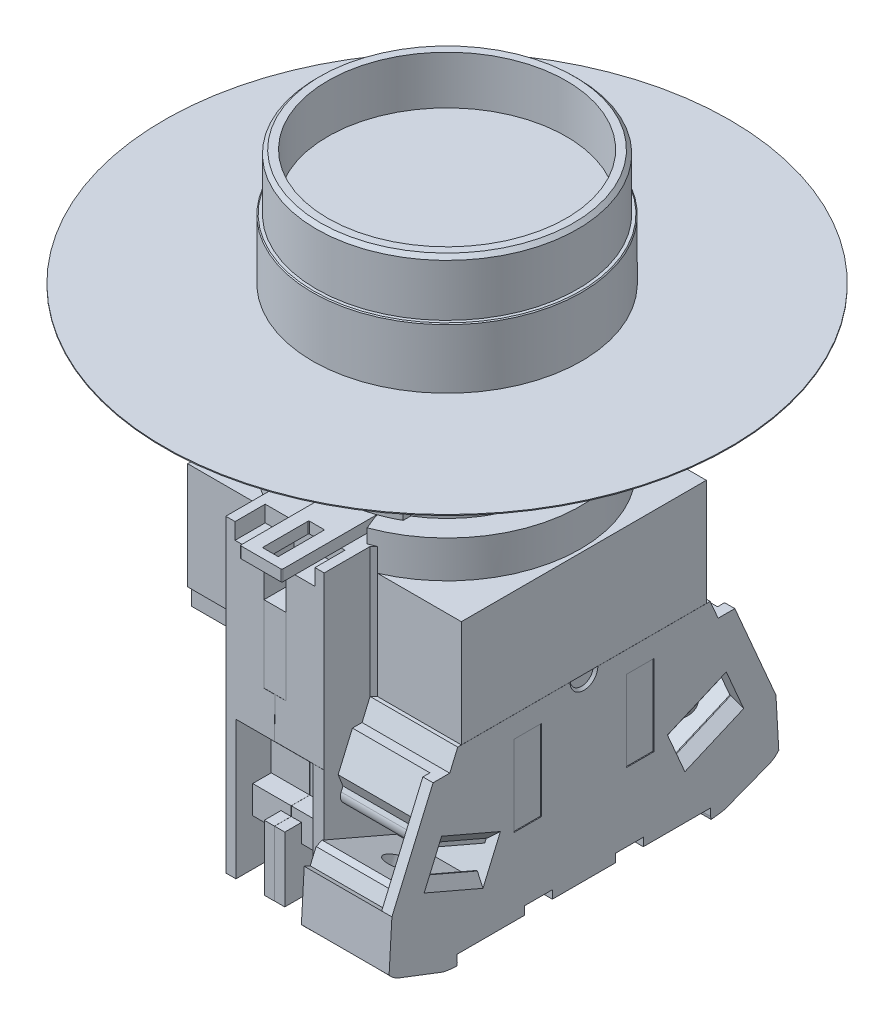
from build123d import *

# Parameters (mm, degrees)
SKETCH_2_R                  = 14.075
EXTRUDE_1_DEPTH             = 6
SKETCH_3_R                  = 14.5
EXTRUDE_2_DEPTH             = 6.5
CHAMFER_1_SIZE              = 0.4
CHAMFER_2_SIZE              = 0.1
SKETCH_4_R                  = 12.85
CUT_EXTRUDE_1_DEPTH         = 5.2
SKETCH_5_R                  = 10.925
EXTRUDE_3_DEPTH             = 12.9
EXTRUDE_4_DEPTH             = 0.7
SKETCH_8_R                  = 14.375
EXTRUDE_5_DEPTH             = 4
CUT_EXTRUDE_2_DEPTH         = 1.5
SKETCH_11_W                 = 10.2
SKETCH_11_H                 = 1.5
CUT_EXTRUDE_4_DEPTH         = 9
FILLET_1_R                  = 2
SKETCH_12_W                 = 4.5
SKETCH_12_H                 = 1.2
EXTRUDE_6_DEPTH             = 12
SKETCH_16_W                 = 1.7
SKETCH_16_H                 = 5
CUT_EXTRUDE_6_DEPTH         = 38.087194556
FILLET_5_R                  = 0.1
SKETCH_17_W                 = 29.5
SKETCH_17_H                 = 26.4
EXTRUDE_9_DEPTH             = 11.5
SKETCH_18_W                 = 29.5
SKETCH_18_H                 = 25.6
EXTRUDE_10_DEPTH            = 2
SKETCH_19_W                 = 29.5
SKETCH_19_H                 = 11
EXTRUDE_11_DEPTH            = 0.3
EXTRUDE_12_DEPTH            = 5.3
EXTRUDE_12_DEPTH_BACK       = 5.3
SKETCH_21_W                 = 37.1
SKETCH_21_H                 = 33.3
CHAMFER_START               = -35.6
CHAMFER_3_DEPTH             = 14
SKETCH_22_W                 = 10
SKETCH_22_H                 = 7.4
SKETCH_22_W_2               = 4
SKETCH_22_H_2               = 15.4
CUT_EXTRUDE_7_DEPTH         = 2.1
EXTRUDE_13_DEPTH            = 1
EXTRUDE_13_DEPTH_BACK       = 1
SKETCH_26_W                 = 8.6
SKETCH_26_H                 = 6.5
CUT_EXTRUDE_8_DEPTH         = 1.75
SKETCH_28_W                 = 8.6
SKETCH_28_H                 = 1
CUT_EXTRUDE_9_DEPTH         = 0.5
CHAMFER_4_SIZE              = 0.5
SKETCH_29_W                 = 2.4
SKETCH_29_H                 = 3.25
CUT_EXTRUDE_10_DEPTH        = 4
SKETCH_30_W                 = 8.3
SKETCH_30_H                 = 14.9
CUT_EXTRUDE_11_DEPTH        = 3.8
CHAMFER_5_SIZE              = 3.8
SKETCH_31_W                 = 8.3
SKETCH_31_H                 = 3
EXTRUDE_14_DEPTH            = 2
CHAMFER_7_SIZE              = 2
SKETCH_33_W                 = 2.2
SKETCH_33_H                 = 7
EXTRUDE_15_DEPTH            = 3.8
EXTRUDE_16_DEPTH            = 9.45
EXTRUDE_17_DEPTH            = 9.45
SKETCH_39_W                 = 27.2
SKETCH_39_H                 = 11.5
CUT_EXTRUDE_12_DEPTH        = 0.01
MIRROR_START                = -4.2
MIRROR_1_OUTLINE_W          = 1.75
MIRROR_1_OUTLINE_H          = 3.25
MIRROR_1_DEPTH              = 8.3
MIRROR_1_2_DEPTH            = 3.05
MIRROR_START_2              = 1.05
MIRROR_1_3_DEPTH            = 3.05
MIRROR_START_3              = -1.2
MIRROR_1_4_OUTLINE_W        = 4
MIRROR_1_4_OUTLINE_H        = 3.25
MIRROR_1_4_DEPTH            = 2.4
MIRROR_START_4              = -4.3
MIRROR_1_5_OUTLINE_W        = 1.75
MIRROR_1_5_OUTLINE_H        = 3.25
MIRROR_1_5_DEPTH            = 8.6
SKETCH_41_W                 = 2.4
SKETCH_41_H                 = 8.25
CUT_EXTRUDE_13_DEPTH        = 0.02
CUT_EXTRUDE_14_DEPTH        = 0.01
SKETCH_44_W                 = 4.15
SKETCH_44_H                 = 5.374011537
CUT_EXTRUDE_15_DEPTH        = 0.01
SKETCH_45_W                 = 4.15
SKETCH_45_H                 = 3.1
CUT_EXTRUDE_16_DEPTH        = 0.01
SKETCH_46_W                 = 4.15
SKETCH_46_H                 = 2.01
CUT_EXTRUDE_17_DEPTH        = 0.01
CUT_EXTRUDE_18_DEPTH        = 0.01
SKETCH_48_W                 = 3.05
SKETCH_48_H                 = 2.828427125
CUT_EXTRUDE_19_DEPTH        = 0.01
SKETCH_49_W                 = 3.05
SKETCH_49_H                 = 3
CUT_EXTRUDE_20_DEPTH        = 0.01
SKETCH_50_W                 = 1.1
SKETCH_50_H                 = 7
CUT_EXTRUDE_21_DEPTH        = 0.01
SKETCH_52_W                 = 1.1
SKETCH_52_H                 = 1.79
CUT_EXTRUDE_24_DEPTH        = 0.01
SKETCH_55_W                 = 8.35
SKETCH_55_H                 = 11.214030016
CUT_EXTRUDE_25_DEPTH        = 0.7
SKETCH_56_W                 = 8.35
SKETCH_56_H                 = 0.7
CUT_EXTRUDE_26_DEPTH        = 0.7
SKETCH_57_W                 = 8.35
SKETCH_57_H                 = 4.5
CUT_EXTRUDE_27_DEPTH        = 8.7
CHAMFER_8_SIZE              = 1
CHAMFER_9_SIZE              = 0.5
CHAMFER_8_OF_MIRROR_2_SIZE  = 1
CHAMFER_9_OF_MIRROR_2_SIZE  = 0.5
SKETCH_58_W                 = 3
SKETCH_58_H                 = 8.7
CUT_EXTRUDE_28_DEPTH        = 0.1
CUT_EXTRUDE_29_DEPTH        = 9.45
CHAMFER_10_SIZE             = 1
CHAMFER_10_OF_MIRROR_4_SIZE = 1
SKETCH_62_W                 = 3
SKETCH_62_H                 = 1.69
CUT_EXTRUDE_30_DEPTH        = 1.77
SKETCH_63_W                 = 27.3
SKETCH_63_H                 = 0.8
CUT_EXTRUDE_31_DEPTH        = 64.419259781
SKETCH_64_R                 = 2.5
CUT_EXTRUDE_32_DEPTH        = 3
SKETCH_65_R                 = 1.6
CUT_EXTRUDE_33_DEPTH        = 6
CUT_EXTRUDE_34_DEPTH        = 4.8
SKETCH_69_W                 = 8.35
SKETCH_69_H                 = 1.040401342
SKETCH_69_H_2               = 0.709598658
CUT_EXTRUDE_35_DEPTH        = 0.5
SKETCH_70_W                 = 8.35
SKETCH_70_H                 = 1.5
EXTRUDE_19_DEPTH            = 8.2
FILLET_7_R                  = 1
FILLET_7_OF_MIRROR_6_R      = 1
SKETCH_71_W                 = 8.2
SKETCH_71_H                 = 4.985857864
SKETCH_71_W_2               = 0.77
CUT_EXTRUDE_36_DEPTH        = 8
EXTRUDE_20_DEPTH            = 0.8
CHAMFER_11_SIZE             = 0.2
SKETCH_74_W                 = 1
SKETCH_74_H                 = 2
CUT_EXTRUDE_37_DEPTH        = 0.5
CHAMFER_12_SIZE             = 0.5
SKETCH_76_W                 = 1
SKETCH_76_H                 = 14
CUT_EXTRUDE_38_DEPTH        = 0.01
SKETCH_77_R                 = 30.5
EXTRUDE_21_DEPTH            = 0.1
SKETCH_78_R                 = 14.5
CUT_EXTRUDE_40_DEPTH        = 0.1


with BuildPart() as part:
    # ｽｹｯﾁ2 → ﾎﾞｽ - 押し出し1 (new body)
    with BuildSketch(Plane(origin=(0, 0, 0), x_dir=(1, 0, 0), z_dir=(0, 1, 0))):
        with Locations(Location((0, 0, 0), (0, 0, 270))):
            Circle(SKETCH_2_R)
    extrude(amount=EXTRUDE_1_DEPTH)

    # ｽｹｯﾁ3 → ﾎﾞｽ - 押し出し2 (add)
    with BuildSketch(Plane.XZ):
        with Locations(Location((0, 0, 0), (0, 0, 90))):
            Circle(SKETCH_3_R)
    extrude(amount=EXTRUDE_2_DEPTH)

    # 面取り1
    chamfer_1_edges = [part.edges().sort_by_distance(p)[0] for p in [
        (0, 6, -14.075),
    ]]
    chamfer(chamfer_1_edges, length=CHAMFER_1_SIZE)

    # 面取り2
    chamfer_2_edges = [part.edges().sort_by_distance(p)[0] for p in [
        (0, 0, -14.5),
    ]]
    chamfer(chamfer_2_edges, length=CHAMFER_2_SIZE)

    # ｽｹｯﾁ4 → ｶｯﾄ - 押し出し1 (cut)
    with BuildSketch(Plane(origin=(0, 6, 0), x_dir=(1, 0, 0), z_dir=(0, 1, 0))):
        with Locations(Location((0, 0, 0), (0, 0, 270))):
            Circle(SKETCH_4_R)
    extrude(amount=-CUT_EXTRUDE_1_DEPTH, mode=Mode.SUBTRACT)

    # ｽｹｯﾁ5 → ﾎﾞｽ - 押し出し3 (add)
    with BuildSketch(Plane.XZ.offset(6.5)):
        with Locations(Location((0, 0, 0), (0, 0, 90))):
            Circle(SKETCH_5_R)
    extrude(amount=EXTRUDE_3_DEPTH)

    # ｽｹｯﾁ7 → ﾎﾞｽ - 押し出し4 (add)
    with BuildSketch(Plane.XZ.offset(19.4)):
        with BuildLine():
            Line((-6.15, 10.882439984), (-6.15, 10.070625601))
            ThreePointArc((-6.15, 10.070625601), (0, -11.8), (6.15, 10.070625601))
            Line((6.15, 10.070625601), (6.15, 10.882439984))
            ThreePointArc((6.15, 10.882439984), (0, 12.5), (-6.15, 10.882439984))
        make_face()
    extrude(amount=EXTRUDE_4_DEPTH)

    # ｽｹｯﾁ8 → ﾎﾞｽ - 押し出し5 (add)
    with BuildSketch(Plane.XZ.offset(20.1)):
        with Locations(Location((0, 0, 0), (0, 0, 270))):
            Circle(SKETCH_8_R)
    extrude(amount=EXTRUDE_5_DEPTH)

    # ｽｹｯﾁ9 → ｶｯﾄ - 押し出し2 (cut)
    with BuildSketch(Plane(origin=(0, -20.1, 0), x_dir=(1, 0, 0), z_dir=(0, 1, 0))):
        with BuildLine():
            Line((-6, -10.9658561), (-7.158425574, -12.4658561))
            ThreePointArc((-7.158425574, -12.4658561), (-1.244917679, -14.320991759), (4.9, -13.514089869))
            Line((4.9, -13.514089869), (4.2, -11.773274821))
            ThreePointArc((4.2, -11.773274821), (-0.986398118, -12.461019972), (-6, -10.9658561))
        make_face()
    extrude(amount=-CUT_EXTRUDE_2_DEPTH, mode=Mode.SUBTRACT)

    # ｽｹｯﾁ11 → ｶｯﾄ - 押し出し4 (cut)
    with BuildSketch(Plane.XY.offset(10)):
        with Locations((-0.9, -20.85)):
            Rectangle(SKETCH_11_W, SKETCH_11_H)
    extrude(amount=CUT_EXTRUDE_4_DEPTH, mode=Mode.SUBTRACT)

    # ﾌｨﾚｯﾄ1
    # the kernel refuses this fillet: 2 mm, written as the material it takes off along each edge
    with BuildSketch(Plane(origin=(-6, -20.1, 10.9658561), x_dir=(0, 0, -1), z_dir=(0, -1, 0))) as fillet_1_piece_1:
        with BuildLine():
            CenterArc((FILLET_1_R * 0.341190669932, -FILLET_1_R), FILLET_1_R, 90, 37.678324583)
            Line((-FILLET_1_R * 0.270037000784, -FILLET_1_R * 0.208545178452), (0, 0))
            Line((0, 0), (FILLET_1_R * 0.341190669932, 0))
        make_face()
    extrude(amount=1.5, mode=Mode.SUBTRACT)
    with BuildSketch(Plane(origin=(4.2, -20.1, 11.773274821), x_dir=(0.37307809411087806, 0, 0.9277999437888509), z_dir=(0, -1, 0))) as fillet_1_piece_2:
        with BuildLine():
            CenterArc((FILLET_1_R * 0.193525316417, -FILLET_1_R), FILLET_1_R, 90, 21.90557703)
            Line((-FILLET_1_R * 0.179552777694, -FILLET_1_R * 0.0722000562111), (0, 0))
            Line((0, 0), (FILLET_1_R * 0.193525316417, 0))
        make_face()
    extrude(amount=1.5, mode=Mode.SUBTRACT)

    # ｽｹｯﾁ12 → ﾎﾞｽ - 押し出し6 (add)
    with BuildSketch(Plane.XY.offset(10)):
        with Locations((1.95, -20.7)):
            Rectangle(SKETCH_12_W, SKETCH_12_H)
    extrude(amount=EXTRUDE_6_DEPTH)

    # ｽｹｯﾁ16 → ｶｯﾄ - 押し出し6 (cut, through all)
    with BuildSketch(Plane(origin=(0, -20.1, 0), x_dir=(1, 0, 0), z_dir=(0, 1, 0))):
        with Locations((1.95, -18.5)):
            Rectangle(SKETCH_16_W, SKETCH_16_H)
    extrude(amount=-CUT_EXTRUDE_6_DEPTH, mode=Mode.SUBTRACT)

    # ﾌｨﾚｯﾄ5
    fillet_5_edges = [part.edges().sort_by_distance(p)[0] for p in [
        (-0.3, -20.7, 10),
        (1.95, -21.3, 10),
        (4.2, -20.7, 22),
        (-0.3, -20.7, 22),
        (1.1, -20.7, 21),
        (1.1, -20.7, 16),
        (2.8, -20.7, 16),
        (2.8, -20.7, 21),
    ]]
    fillet(fillet_5_edges, radius=FILLET_5_R)

    # ｽｹｯﾁ17 → ﾎﾞｽ - 押し出し9 (add)
    with BuildSketch(Plane.XZ.offset(24.1)):
        Rectangle(SKETCH_17_W, SKETCH_17_H)
    extrude(amount=EXTRUDE_9_DEPTH)

    # ｽｹｯﾁ18 → ﾎﾞｽ - 押し出し10 (add)
    with BuildSketch(Plane.XZ.offset(35.6)):
        Rectangle(SKETCH_18_W, SKETCH_18_H)
    extrude(amount=EXTRUDE_10_DEPTH)

    # ｽｹｯﾁ19 → ﾎﾞｽ - 押し出し11 (add)
    with BuildSketch(Plane.XZ.offset(37.6)):
        Rectangle(SKETCH_19_W, SKETCH_19_H)
    extrude(amount=EXTRUDE_11_DEPTH)

    # ｽｹｯﾁ21 → ﾎﾞｽ - 押し出し12 (add, two sides: drawn at the far end of the back side and taken through both)
    with BuildSketch(Plane(origin=(0, 0, 0), x_dir=(0, 0, -1), z_dir=(1, 0, 0)).offset(-EXTRUDE_12_DEPTH_BACK)):
        with Locations((0, -38.25)):
            Rectangle(SKETCH_21_W, SKETCH_21_H)
    extrude(amount=EXTRUDE_12_DEPTH + EXTRUDE_12_DEPTH_BACK)

    # 面取り3: read off the stored shape, not the designer's step
    # 面取り3 outline → 面取り3 (add)
    with BuildSketch(Plane(origin=(0, 0, 0), x_dir=(1, 0, 0), z_dir=(0, 1, 0)).offset(CHAMFER_START)):
        with BuildLine():
            Line((5.3, 13.6), (5.3, 13.2))
            Line((5.3, 13.2), (5.692154687, 13.2))
            ThreePointArc((5.692154687, 13.2), (5.69905966, 13.197020269), (5.705963074, 13.194036925))
            Line((5.705963074, 13.194036925), (5.3, 13.6))
        make_face()
        with BuildLine():
            Line((-5.3, -13.6), (-5.3, -13.2))
            Line((-5.3, -13.2), (-5.69215469, -13.2))
            ThreePointArc((-5.69215469, -13.2), (-5.699059662, -13.197020269), (-5.705963074, -13.194036926))
            Line((-5.705963074, -13.194036926), (-5.3, -13.6))
        make_face()
        with BuildLine():
            ThreePointArc((-5.705963074, 13.194036926), (-5.699059661, 13.197020269), (-5.692154689, 13.2))
            Line((-5.692154689, 13.2), (-5.3, 13.2))
            Line((-5.3, 13.2), (-5.3, 13.6))
            Line((-5.3, 13.6), (-5.705963074, 13.194036926))
        make_face()
        with BuildLine():
            Line((5.692154687, -13.2), (5.3, -13.2))
            Line((5.3, -13.2), (5.3, -13.6))
            Line((5.3, -13.6), (5.705963074, -13.194036925))
            ThreePointArc((5.705963074, -13.194036925), (5.69905966, -13.197020269), (5.692154687, -13.2))
        make_face()
    extrude(amount=CHAMFER_3_DEPTH)

    # ｽｹｯﾁ22 → ｶｯﾄ - 押し出し7 (cut)
    with BuildSketch(Plane.ZY.offset(5.3)):
        with Locations((0, -41.6)):
            Rectangle(SKETCH_22_W, SKETCH_22_H)
        with Locations((11.35, -45.3)):
            Rectangle(SKETCH_22_W_2, SKETCH_22_H_2)
        with Locations((-11.35, -45.3)):
            Rectangle(SKETCH_22_W_2, SKETCH_22_H_2)
    extrude(amount=-CUT_EXTRUDE_7_DEPTH, mode=Mode.SUBTRACT)

    # ｽｹｯﾁ25 → ﾎﾞｽ - 押し出し13 (add, two sides: drawn at the far end of the back side and taken through both)
    with BuildSketch(Plane.XY.offset(-EXTRUDE_13_DEPTH_BACK)):
        Polygon((-10.025, -37.9), (-3.2, -45.3), (-3.2, -37.9), align=None)
    extrude(amount=EXTRUDE_13_DEPTH + EXTRUDE_13_DEPTH_BACK)

    # ｽｹｯﾁ26 → ｶｯﾄ - 押し出し8 (cut)
    with BuildSketch(Plane(origin=(0, -21.6, 0), x_dir=(1, 0, 0), z_dir=(0, 1, 0))):
        with Locations((0, 18.55)):
            Rectangle(SKETCH_26_W, SKETCH_26_H)
    extrude(amount=-CUT_EXTRUDE_8_DEPTH, mode=Mode.SUBTRACT)

    # ｽｹｯﾁ28 → ｶｯﾄ - 押し出し9 (cut)
    with BuildSketch(Plane(origin=(0, -23.35, 0), x_dir=(1, 0, 0), z_dir=(0, 1, 0))):
        with Locations((0, 15.8)):
            Rectangle(SKETCH_28_W, SKETCH_28_H)
    extrude(amount=-CUT_EXTRUDE_9_DEPTH, mode=Mode.SUBTRACT)

    # 面取り4
    chamfer_4_edges = [part.edges().sort_by_distance(p)[0] for p in [
        (0, -23.85, -16.3),
    ]]
    chamfer(chamfer_4_edges, length=CHAMFER_4_SIZE - 0.0001)  # a hair under: the kernel refuses the full size

    # ｽｹｯﾁ29 → ｶｯﾄ - 押し出し10 (cut)
    with BuildSketch(Plane(origin=(0, -23.35, 0), x_dir=(1, 0, 0), z_dir=(0, 1, 0))):
        with Locations((0, 16.925)):
            Rectangle(SKETCH_29_W, SKETCH_29_H)
    extrude(amount=-CUT_EXTRUDE_10_DEPTH, mode=Mode.SUBTRACT)

    # ｽｹｯﾁ30 → ｶｯﾄ - 押し出し11 (cut)
    with BuildSketch(Plane(origin=(0, 0, -18.55), x_dir=(-1, 0, 0), z_dir=(0, 0, -1))):
        with Locations((0.05, -47.45)):
            Rectangle(SKETCH_30_W, SKETCH_30_H)
    extrude(amount=-CUT_EXTRUDE_11_DEPTH, mode=Mode.SUBTRACT)

    # 面取り5
    chamfer_5_edges = [part.edges().sort_by_distance(p)[0] for p in [
        (-0.05, -40, -14.75),
    ]]
    chamfer(chamfer_5_edges, length=CHAMFER_5_SIZE - 0.0001)  # a hair under: the kernel refuses the full size

    # ｽｹｯﾁ31 → ﾎﾞｽ - 押し出し14 (add)
    with BuildSketch(Plane(origin=(0, 0, -14.75), x_dir=(-1, 0, 0), z_dir=(0, 0, -1))):
        with Locations((0.05, -48.4)):
            Rectangle(SKETCH_31_W, SKETCH_31_H)
    extrude(amount=EXTRUDE_14_DEPTH)

    # 面取り7
    chamfer_7_edges = [part.edges().sort_by_distance(p)[0] for p in [
        (-0.05, -49.9, -14.75),
    ]]
    chamfer(chamfer_7_edges, length=CHAMFER_7_SIZE - 0.0001)  # a hair under: the kernel refuses the full size

    # ｽｹｯﾁ33 → ﾎﾞｽ - 押し出し15 (add)
    with BuildSketch(Plane(origin=(0, 0, -14.75), x_dir=(-1, 0, 0), z_dir=(0, 0, -1))):
        with Locations((0.05, -51.4)):
            Rectangle(SKETCH_33_W, SKETCH_33_H)
    extrude(amount=EXTRUDE_15_DEPTH)

    # ｽｹｯﾁ34 → ﾎﾞｽ - 押し出し16 (add)
    with BuildSketch(Plane(origin=(5.3, 0, 0), x_dir=(0, 0, -1), z_dir=(1, 0, 0))):
        Polygon((13.6, -35.6), (14.461060932, -37.6), (16.261060932, -37.6), (20.695524732, -47.9), (21, -53.191247), (13.7, -56), (13.647101906, -55.7), (-13.647101906, -55.7), (-13.7, -56), (-21, -53.191247), (-20.695524732, -47.9), (-16.261060932, -37.6), (-14.461060932, -37.6), (-13.6, -35.6), align=None)
    extrude(amount=EXTRUDE_16_DEPTH)

    # ｽｹｯﾁ35 → ﾎﾞｽ - 押し出し17 (add)
    with BuildSketch(Plane(origin=(14.75, 0, 0), x_dir=(0, 0, -1), z_dir=(1, 0, 0))):
        with BuildLine():
            Line((15.2, -55.7978723), (19.866500814, -54.002386251))
            add(Edge.make_bspline(
                [(21, -53.191247), (20.549671392, -53.738303802), (19.866500814, -54.002386251)],
                knots=[0, 0, 0, 1, 1, 1], degree=2))
            Line((21, -53.191247), (13.7, -56))
            add(Edge.make_bspline(
                [(13.7, -56), (14.457977521, -55.96227272), (15.2, -55.7978723)],
                knots=[0, 0, 0, 1, 1, 1], degree=2))
        make_face()
        with BuildLine():
            Line((-13.7, -56), (-21, -53.191247))
            add(Edge.make_bspline(
                [(-21, -53.191247), (-20.549671392, -53.738303802), (-19.866500814, -54.002386251)],
                knots=[0, 0, 0, 1, 1, 1], degree=2))
            Line((-19.866500814, -54.002386251), (-15.2, -55.7978723))
            add(Edge.make_bspline(
                [(-13.7, -56), (-14.457977521, -55.96227272), (-15.2, -55.7978723)],
                knots=[0, 0, 0, 1, 1, 1], degree=2))
        make_face()
    extrude(amount=-EXTRUDE_17_DEPTH)

    # ｽｹｯﾁ36 → ｶｯﾄ - ﾛﾌﾄ1 section 0
    with BuildSketch(Plane(origin=(14.75, 0, 0), x_dir=(0, 0, -1), z_dir=(1, 0, 0))):
        with BuildLine():
            Line((-1.5, -35.6), (1.5, -35.6))
            ThreePointArc((1.5, -35.6), (0, -37.1), (-1.5, -35.6))
        make_face()
    # ｽｹｯﾁ38 → ｶｯﾄ - ﾛﾌﾄ1 section 1
    with BuildSketch(Plane(origin=(14.5, 0, 0), x_dir=(0, 0, -1), z_dir=(1, 0, 0))):
        with BuildLine():
            Line((-1.25, -35.6), (1.25, -35.6))
            ThreePointArc((1.25, -35.6), (0, -36.85), (-1.25, -35.6))
        make_face()
    loft(mode=Mode.SUBTRACT)

    # ｽｹｯﾁ39 → ｶｯﾄ - 押し出し12 (cut)
    with BuildSketch(Plane(origin=(14.75, 0, 0), x_dir=(0, 0, -1), z_dir=(1, 0, 0))):
        with Locations((0, -29.85)):
            Rectangle(SKETCH_39_W, SKETCH_39_H)
    extrude(amount=-CUT_EXTRUDE_12_DEPTH, mode=Mode.SUBTRACT)

    # ﾐﾗｰ1: read off the stored shape, not the designer's step
    # ﾐﾗｰ1 outline → ﾐﾗｰ1 (cut)
    with BuildSketch(Plane.YZ.offset(MIRROR_START)):
        Polygon((-40, 18.55), (-47.9, 18.55), (-47.9, 16.75), (-46.9, 16.75), (-46.9, 14.75), (-43.8, 14.75), align=None)
        with Locations((-22.475, 16.925)):
            Rectangle(MIRROR_1_OUTLINE_W, MIRROR_1_OUTLINE_H)
    extrude(amount=MIRROR_1_DEPTH, mode=Mode.SUBTRACT)

    # Mirror 1 2 outline → Mirror 1 2 (cut)
    with BuildSketch(Plane.YZ.offset(MIRROR_START)):
        Polygon((-54.9, 18.55), (-54.9, 14.75), (-51.9, 14.75), (-49.9, 16.75), (-47.9, 16.75), (-47.9, 18.55), align=None)
    extrude(amount=MIRROR_1_2_DEPTH, mode=Mode.SUBTRACT)

    # Mirror 1 3 outline → Mirror 1 3 (cut)
    with BuildSketch(Plane.YZ.offset(MIRROR_START_2)):
        Polygon((-54.9, 18.55), (-54.9, 14.75), (-51.9, 14.75), (-49.9, 16.75), (-47.9, 16.75), (-47.9, 18.55), align=None)
    extrude(amount=MIRROR_1_3_DEPTH, mode=Mode.SUBTRACT)

    # Mirror 1 4 outline → Mirror 1 4 (cut)
    with BuildSketch(Plane.YZ.offset(MIRROR_START_3)):
        with Locations((-25.35, 16.925)):
            Rectangle(MIRROR_1_4_OUTLINE_W, MIRROR_1_4_OUTLINE_H)
    extrude(amount=MIRROR_1_4_DEPTH, mode=Mode.SUBTRACT)

    # Mirror 1 5 outline → Mirror 1 5 (cut)
    with BuildSketch(Plane.YZ.offset(MIRROR_START_4)):
        with Locations((-22.475, 16.925)):
            Rectangle(MIRROR_1_5_OUTLINE_W, MIRROR_1_5_OUTLINE_H)
    extrude(amount=MIRROR_1_5_DEPTH, mode=Mode.SUBTRACT)

    # ｽｹｯﾁ41 → ｶｯﾄ - 押し出し13 (cut)
    with BuildSketch(Plane.XY.offset(18.55)):
        with Locations((0, -31.475)):
            Rectangle(SKETCH_41_W, SKETCH_41_H)
    cut_extrude_13 = extrude(amount=-CUT_EXTRUDE_13_DEPTH, mode=Mode.SUBTRACT)

    # ｽｹｯﾁ42 → ｶｯﾄ - 押し出し14 (cut)
    with BuildSketch(Plane.XY.offset(18.55)):
        Polygon((0, -35.6), (-0.05, -40), (5.3, -40), (5.302981537, -21.6), (4.344400112, -21.6), (4.3, -23.35), (1.2, -23.35), (1.2, -35.6), align=None)
    cut_extrude_14 = extrude(amount=-CUT_EXTRUDE_14_DEPTH, mode=Mode.SUBTRACT)

    # ｽｹｯﾁ44 → ｶｯﾄ - 押し出し15 (cut)
    with BuildSketch(Plane(origin=(0, -29.275, 29.275), x_dir=(1, 0, 0), z_dir=(0, -0.7071067811865438, 0.7071067811865513))):
        with Locations((2.025, -17.854446225)):
            Rectangle(SKETCH_44_W, SKETCH_44_H)
    cut_extrude_15 = extrude(amount=-CUT_EXTRUDE_15_DEPTH, mode=Mode.SUBTRACT)

    # ｽｹｯﾁ45 → ｶｯﾄ - 押し出し16 (cut)
    with BuildSketch(Plane.XY.offset(14.75)):
        with Locations((2.025, -45.35)):
            Rectangle(SKETCH_45_W, SKETCH_45_H)
    cut_extrude_16 = extrude(amount=-CUT_EXTRUDE_16_DEPTH, mode=Mode.SUBTRACT)

    # ｽｹｯﾁ46 → ｶｯﾄ - 押し出し17 (cut)
    with BuildSketch(Plane(origin=(0, -46.9, 0), x_dir=(1, 0, 0), z_dir=(0, 1, 0))):
        with Locations((2.025, -15.745)):
            Rectangle(SKETCH_46_W, SKETCH_46_H)
    cut_extrude_17 = extrude(amount=-CUT_EXTRUDE_17_DEPTH, mode=Mode.SUBTRACT)

    # ｽｹｯﾁ47 → ｶｯﾄ - 押し出し18 (cut)
    with BuildSketch(Plane.XY.offset(16.75)):
        Polygon((-0.05, -46.91), (-0.05, -47.9), (1.05, -47.9), (1.05, -49.9), (4.1, -49.9), (4.1, -46.91), align=None)
    cut_extrude_18 = extrude(amount=-CUT_EXTRUDE_18_DEPTH, mode=Mode.SUBTRACT)

    # ｽｹｯﾁ48 → ｶｯﾄ - 押し出し19 (cut)
    with BuildSketch(Plane(origin=(0, -33.325, 33.325), x_dir=(1, 0, 0), z_dir=(0, -0.7071067811865502, 0.7071067811865449))):
        with Locations((2.575, -24.854803358)):
            Rectangle(SKETCH_48_W, SKETCH_48_H)
    cut_extrude_19 = extrude(amount=-CUT_EXTRUDE_19_DEPTH, mode=Mode.SUBTRACT)

    # ｽｹｯﾁ49 → ｶｯﾄ - 押し出し20 (cut)
    with BuildSketch(Plane.XY.offset(14.75)):
        with Locations((2.575, -53.4)):
            Rectangle(SKETCH_49_W, SKETCH_49_H)
    cut_extrude_20 = extrude(amount=-CUT_EXTRUDE_20_DEPTH, mode=Mode.SUBTRACT)

    # ｽｹｯﾁ50 → ｶｯﾄ - 押し出し21 (cut)
    with BuildSketch(Plane.XY.offset(18.55)):
        with Locations((0.5, -51.4)):
            Rectangle(SKETCH_50_W, SKETCH_50_H)
    cut_extrude_21 = extrude(amount=-CUT_EXTRUDE_21_DEPTH, mode=Mode.SUBTRACT)

    # ｽｹｯﾁ52 → ｶｯﾄ - 押し出し24 (cut)
    with BuildSketch(Plane(origin=(0, -47.9, 0), x_dir=(1, 0, 0), z_dir=(0, 1, 0))):
        with Locations((0.5, -17.645)):
            Rectangle(SKETCH_52_W, SKETCH_52_H)
    cut_extrude_24 = extrude(amount=-CUT_EXTRUDE_24_DEPTH, mode=Mode.SUBTRACT)

    # ｽｹｯﾁ55 → ｶｯﾄ - 押し出し25 (cut)
    with BuildSketch(Plane(origin=(0, 0.026556072, 0.061682213), x_dir=(1, 0, 0), z_dir=(0, 0.39543890943366256, 0.9184922802647368))):
        with Locations((9.475, -46.572580947)):
            Rectangle(SKETCH_55_W, SKETCH_55_H)
    cut_extrude_25 = extrude(amount=-CUT_EXTRUDE_25_DEPTH, mode=Mode.SUBTRACT)

    # ｽｹｯﾁ56 → ｶｯﾄ - 押し出し26 (cut)
    with BuildSketch(Plane(origin=(0, -37.626556072, 16.199378719), x_dir=(1, 0, 0), z_dir=(0, -0.9184922802647368, 0.39543890943366256))):
        with Locations((9.475, -0.28284406)):
            Rectangle(SKETCH_56_W, SKETCH_56_H)
    cut_extrude_26 = extrude(amount=-CUT_EXTRUDE_26_DEPTH, mode=Mode.SUBTRACT)

    # ｽｹｯﾁ57 → ｶｯﾄ - 押し出し27 (cut)
    with BuildSketch(Plane(origin=(0, -0.250251165, -0.581262384), x_dir=(1, 0, 0), z_dir=(0, 0.3954389094336629, 0.9184922802647366))):
        with Locations((9.475, -47.814194613)):
            Rectangle(SKETCH_57_W, SKETCH_57_H)
    cut_extrude_27 = extrude(amount=-CUT_EXTRUDE_27_DEPTH, mode=Mode.SUBTRACT)

    # 面取り8
    chamfer_8_edges = [part.edges().sort_by_distance(p)[0] for p in [
        (9.475, -42.100612173, 17.436593043),
    ]]
    chamfer(chamfer_8_edges, length=CHAMFER_8_SIZE)

    # 面取り9
    chamfer_9_edges = [part.edges().sort_by_distance(p)[0] for p in [
        (9.475, -46.233827434, 19.216068136),
    ]]
    chamfer(chamfer_9_edges, length=CHAMFER_9_SIZE)

    # ﾐﾗｰ2: ｶｯﾄ - 押し出し13, ｶｯﾄ - 押し出し14, ｶｯﾄ - 押し出し15, ｶｯﾄ - 押し出し16, ｶｯﾄ - 押し出し17, ｶｯﾄ - 押し出し18, ｶｯﾄ - 押し出し19, ｶｯﾄ - 押し出し20, ｶｯﾄ - 押し出し21, ｶｯﾄ - 押し出し24, ｶｯﾄ - 押し出し25, ｶｯﾄ - 押し出し26, ｶｯﾄ - 押し出し27 across plane
    add(cut_extrude_13.mirror(Plane.XY), mode=Mode.SUBTRACT)
    add(cut_extrude_14.mirror(Plane.XY), mode=Mode.SUBTRACT)
    add(cut_extrude_15.mirror(Plane.XY), mode=Mode.SUBTRACT)
    add(cut_extrude_16.mirror(Plane.XY), mode=Mode.SUBTRACT)
    add(cut_extrude_17.mirror(Plane.XY), mode=Mode.SUBTRACT)
    add(cut_extrude_18.mirror(Plane.XY), mode=Mode.SUBTRACT)
    add(cut_extrude_19.mirror(Plane.XY), mode=Mode.SUBTRACT)
    add(cut_extrude_20.mirror(Plane.XY), mode=Mode.SUBTRACT)
    add(cut_extrude_21.mirror(Plane.XY), mode=Mode.SUBTRACT)
    add(cut_extrude_24.mirror(Plane.XY), mode=Mode.SUBTRACT)
    add(cut_extrude_25.mirror(Plane.XY), mode=Mode.SUBTRACT)
    add(cut_extrude_26.mirror(Plane.XY), mode=Mode.SUBTRACT)
    add(cut_extrude_27.mirror(Plane.XY), mode=Mode.SUBTRACT)

    # 面取り8 of ﾐﾗｰ2
    chamfer_8_of_mirror_2_edges = [part.edges().sort_by_distance(p)[0] for p in [
        (9.475, -42.100612173, -17.436593043),
    ]]
    chamfer(chamfer_8_of_mirror_2_edges, length=CHAMFER_8_OF_MIRROR_2_SIZE)

    # 面取り9 of ﾐﾗｰ2
    chamfer_9_of_mirror_2_edges = [part.edges().sort_by_distance(p)[0] for p in [
        (9.475, -46.233827434, -19.216068136),
    ]]
    chamfer(chamfer_9_of_mirror_2_edges, length=CHAMFER_9_OF_MIRROR_2_SIZE)

    # ｽｹｯﾁ58 → ｶｯﾄ - 押し出し28 (cut)
    with BuildSketch(Plane(origin=(14.75, 0, 0), x_dir=(0, 0, -1), z_dir=(1, 0, 0))):
        with Locations((-6.061060932, -42.25)):
            Rectangle(SKETCH_58_W, SKETCH_58_H)
        with Locations((6.061060932, -42.25)):
            Rectangle(SKETCH_58_W, SKETCH_58_H)
    extrude(amount=-CUT_EXTRUDE_28_DEPTH, mode=Mode.SUBTRACT)

    # ｽｹｯﾁ59 → ｶｯﾄ - 押し出し29 (cut)
    with BuildSketch(Plane(origin=(14.75, 0, 0), x_dir=(0, 0, -1), z_dir=(1, 0, 0))):
        Polygon((15.735475971, -43.965722266), (9.397879237, -46.694250741), (10.485336238, -49.220104512), (16.822932972, -46.491576037), align=None)
    cut_extrude_29 = extrude(amount=-CUT_EXTRUDE_29_DEPTH, mode=Mode.SUBTRACT)

    # 面取り10
    chamfer_10_edges = [part.edges().sort_by_distance(p)[0] for p in [
        (14.75, -45.329986503, -12.566677604),
        (14.75, -47.855840274, -13.654134605),
    ]]
    chamfer(chamfer_10_edges, length=CHAMFER_10_SIZE)

    # ﾐﾗｰ4: ｶｯﾄ - 押し出し29 across plane
    add(cut_extrude_29.mirror(Plane.XY), mode=Mode.SUBTRACT)

    # 面取り10 of ﾐﾗｰ4
    chamfer_10_of_mirror_4_edges = [part.edges().sort_by_distance(p)[0] for p in [
        (14.75, -45.329986503, 12.566677604),
        (14.75, -47.855840274, 13.654134605),
    ]]
    chamfer(chamfer_10_of_mirror_4_edges, length=CHAMFER_10_OF_MIRROR_4_SIZE)

    # ｽｹｯﾁ62 → ｶｯﾄ - 押し出し30 (cut)
    with BuildSketch(Plane(origin=(14.75, 0, 0), x_dir=(0, 0, -1), z_dir=(1, 0, 0))):
        with Locations((-4.9, -54.855)):
            Rectangle(SKETCH_62_W, SKETCH_62_H)
        with Locations((4.9, -54.855)):
            Rectangle(SKETCH_62_W, SKETCH_62_H)
    extrude(amount=-CUT_EXTRUDE_30_DEPTH, mode=Mode.SUBTRACT)

    # ｽｹｯﾁ63 → ｶｯﾄ - 押し出し31 (cut, through all)
    with BuildSketch(Plane.ZY.offset(-5.3)):
        with Locations((0.002898094, -55.3)):
            Rectangle(SKETCH_63_W, SKETCH_63_H)
    extrude(amount=-CUT_EXTRUDE_31_DEPTH, mode=Mode.SUBTRACT)

    # ｽｹｯﾁ64 → ｶｯﾄ - 押し出し32 (cut)
    with BuildSketch(Plane(origin=(0, -53.696903048, -20.660457198), x_dir=(1, 0, 0), z_dir=(0, -0.933300162769721, -0.3590972099223447))):
        with Locations(Location((10.025, 3.350517788, 0), (0, 0, 270))):
            Circle(SKETCH_64_R)
    cut_extrude_32 = extrude(amount=-CUT_EXTRUDE_32_DEPTH, mode=Mode.SUBTRACT)

    # ｽｹｯﾁ65 → ｶｯﾄ - 押し出し33 (cut)
    with BuildSketch(Plane(origin=(0, -50.89700256, -19.583165569), x_dir=(1, 0, 0), z_dir=(0, -0.933300162769721, -0.35909720992234473))):
        with Locations(Location((10.025, 3.350517788, 0), (0, 0, 270))):
            Circle(SKETCH_65_R)
    cut_extrude_33 = extrude(amount=-CUT_EXTRUDE_33_DEPTH, mode=Mode.SUBTRACT)

    # ｽｹｯﾁ67 → ｶｯﾄ - 押し出し34 (cut)
    with BuildSketch(Plane.XZ.offset(54.9)):
        Polygon((12.58, 11.542928932), (12.58, 9.892928932), (11.05, 9.892928932), (11.05, 8.892928932), (12.58, 8.892928932), (12.58, 3.442928932), (4.38, 3.442928932), (4.38, 6.442928932), (3.08, 6.442928932), (3.08, 11.542928932), align=None)
        Polygon((4.38, -6.442928932), (3.08, -6.442928932), (3.08, -11.542928932), (12.58, -11.542928932), (12.58, -9.892928932), (11.05, -9.892928932), (11.05, -8.892928932), (12.58, -8.892928932), (12.58, -3.442928932), (4.38, -3.442928932), align=None)
    extrude(amount=-CUT_EXTRUDE_34_DEPTH, mode=Mode.SUBTRACT)

    # ｽｹｯﾁ69 → ｶｯﾄ - 押し出し35 (cut)
    with BuildSketch(Plane(origin=(0, -3.690569677, 8.572145222), x_dir=(-1, 0, 0), z_dir=(0, 0.3954389094336624, -0.9184922802647368))):
        with Locations((-9.475, -46.084395284)):
            Rectangle(SKETCH_69_W, SKETCH_69_H)
        with Locations((-9.475, -49.709395284)):
            Rectangle(SKETCH_69_W, SKETCH_69_H_2)
    cut_extrude_35 = extrude(amount=-CUT_EXTRUDE_35_DEPTH, mode=Mode.SUBTRACT)

    # ﾐﾗｰ5: ｶｯﾄ - 押し出し32, ｶｯﾄ - 押し出し33, ｶｯﾄ - 押し出し35 across plane
    add(cut_extrude_32.mirror(Plane.XY), mode=Mode.SUBTRACT)
    add(cut_extrude_33.mirror(Plane.XY), mode=Mode.SUBTRACT)
    add(cut_extrude_35.mirror(Plane.XY), mode=Mode.SUBTRACT)

    # ｽｹｯﾁ70 → ﾎﾞｽ - 押し出し19 (add)
    with BuildSketch(Plane(origin=(0, -3.888289132, 9.031391362), x_dir=(-1, 0, 0), z_dir=(0, 0.3954389094336638, -0.9184922802647362))):
        with Locations((-9.475, -46.314194613)):
            Rectangle(SKETCH_70_W, SKETCH_70_H)
    extrude_19 = extrude(amount=EXTRUDE_19_DEPTH)

    # ﾌｨﾚｯﾄ7
    fillet_7_edges = [part.edges().sort_by_distance(p)[0] for p in [
        (9.475, -43.873789503, -17.111259127),
    ]]
    fillet(fillet_7_edges, radius=FILLET_7_R)

    # ﾐﾗｰ6: ﾎﾞｽ - 押し出し19 across plane
    add(extrude_19.mirror(Plane.XY))

    # ﾌｨﾚｯﾄ7 of ﾐﾗｰ6
    fillet_7_of_mirror_6_edges = [part.edges().sort_by_distance(p)[0] for p in [
        (9.475, -43.873789503, 17.111259127),
    ]]
    fillet(fillet_7_of_mirror_6_edges, radius=FILLET_7_OF_MIRROR_6_R)

    # ｽｹｯﾁ71 → ｶｯﾄ - 押し出し36 (cut)
    with BuildSketch(Plane.XZ.offset(54.9)):
        with Locations((8.48, 0)):
            Rectangle(SKETCH_71_W, SKETCH_71_H)
        with Locations((13.365, 0)):
            Rectangle(SKETCH_71_W_2, SKETCH_71_H)
    extrude(amount=-CUT_EXTRUDE_36_DEPTH, mode=Mode.SUBTRACT)

    # ｽｹｯﾁ72 → ﾎﾞｽ - 押し出し20 (add)
    with BuildSketch(Plane.XZ.offset(54.9)):
        Polygon((3.38, 5), (3.38, -5), (-0.32, -5), (-0.32, -3.75), (-2.72, -3.75), (-2.72, 3.75), (-0.32, 3.75), (-0.32, 5), align=None)
    extrude(amount=EXTRUDE_20_DEPTH)

    # 面取り11
    chamfer_11_edges = [part.edges().sort_by_distance(p)[0] for p in [
        (1.53, -55.7, 5),
        (-0.32, -55.7, 4.375),
        (-1.52, -55.7, 3.75),
        (-2.72, -55.7, 0),
        (-1.52, -55.7, -3.75),
        (-0.32, -55.7, -4.375),
        (1.53, -55.7, -5),
        (3.38, -55.7, 0),
    ]]
    chamfer(chamfer_11_edges, length=CHAMFER_11_SIZE)

    # ｽｹｯﾁ74 → ｶｯﾄ - 押し出し37 (cut)
    with BuildSketch(Plane.XZ.offset(54.9)):
        with Locations((1.18, 7.442928932)):
            Rectangle(SKETCH_74_W, SKETCH_74_H)
        with Locations((1.18, -7.442928932)):
            Rectangle(SKETCH_74_W, SKETCH_74_H)
    extrude(amount=-CUT_EXTRUDE_37_DEPTH, mode=Mode.SUBTRACT)

    # 面取り12
    chamfer_12_edges = [part.edges().sort_by_distance(p)[0] for p in [
        (0.68, -54.4, 7.442928932),
        (0.68, -54.4, -7.442928932),
    ]]
    chamfer(chamfer_12_edges, length=CHAMFER_12_SIZE - 0.0001)  # a hair under: the kernel refuses the full size

    # ｽｹｯﾁ76 → ｶｯﾄ - 押し出し38 (cut)
    with BuildSketch(Plane.XY.offset(18.55)):
        with Locations((4.8, -28.6)):
            Rectangle(SKETCH_76_W, SKETCH_76_H)
    extrude(amount=-CUT_EXTRUDE_38_DEPTH, mode=Mode.SUBTRACT)

    # ｽｹｯﾁ77 → ﾎﾞｽ - 押し出し21 (add)
    with BuildSketch(Plane.XZ.offset(6.5)):
        with Locations(Location((0, 0, 0), (0, 0, 270))):
            Circle(SKETCH_77_R)
    extrude(amount=EXTRUDE_21_DEPTH)

    # ｽｹｯﾁ78 → ｶｯﾄ - 押し出し40 (cut)
    with BuildSketch(Plane(origin=(0, -6.5, 0), x_dir=(1, 0, 0), z_dir=(0, 1, 0))):
        with Locations(Location((0, 0, 0), (0, 0, 270))):
            Circle(SKETCH_78_R)
    extrude(amount=-CUT_EXTRUDE_40_DEPTH, mode=Mode.SUBTRACT)


with BuildPart() as cut_extrude_40_piece_1:
    # of the separate pieces the step leaves, piece 1, a body of its own (cut_extrude_40_pieces)
    add(part.part.solids().sort_by_distance((0.68, -54.8999, 6.442928932))[0])


with BuildPart() as cut_extrude_40_piece_2:
    # of the separate pieces the step leaves, piece 2, a body of its own (cut_extrude_40_pieces)
    add(part.part.solids().sort_by_distance((0, -0.1, 14.5))[0])


with BuildPart() as cut_extrude_40_piece_3:
    # of the separate pieces the step leaves, piece 3, a body of its own (cut_extrude_40_pieces)
    add(part.part.solids().sort_by_distance((0, -6.6, -30.5))[0])


solid = Compound([cut_extrude_40_piece_1.part, cut_extrude_40_piece_2.part, cut_extrude_40_piece_3.part])
